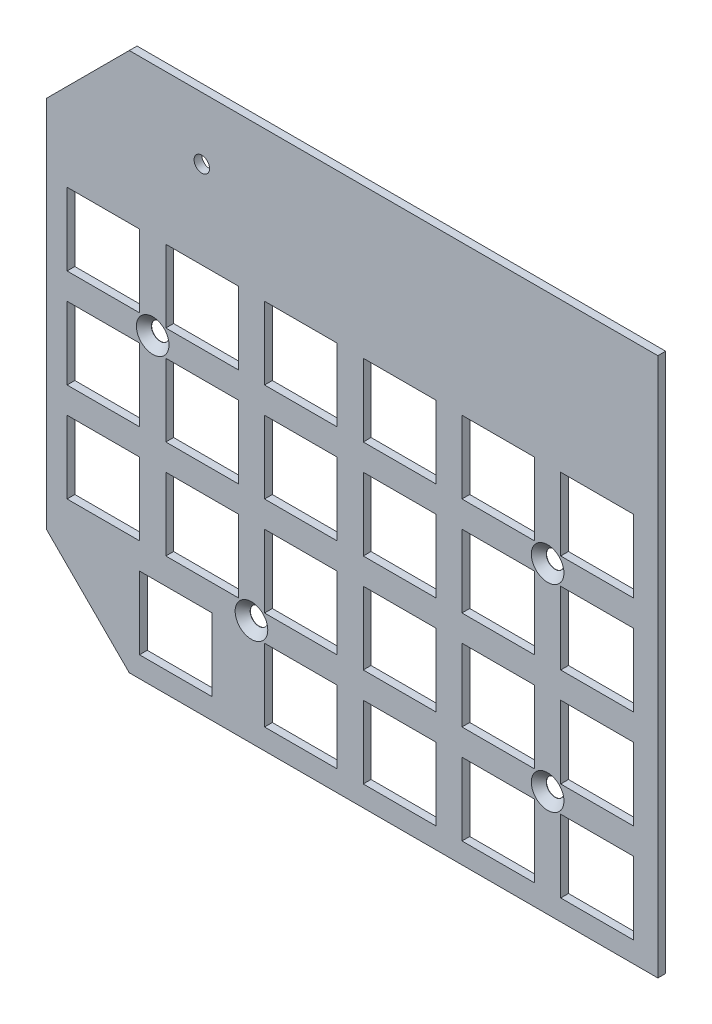
from build123d import *

# Parameters (mm, degrees)
BOSS_EXTRU_1_DEPTH                          = 1.5
ESQUISSE2_R                                 = 1.5
ESQUISSE2_W                                 = 14
ESQUISSE2_H                                 = 14
ENL_V_MAT_EXTRU_1_DEPTH                     = 1.5
FRAISAGE_POUR_VIS_T_TE_FRAIS_E_M31_AT_COUNT = 2
FRAISAGE_POUR_VIS_T_TE_FRAIS_E_M31_AT_PITCH = 76.2
FRAISAGE_POUR_VIS_T_TE_FRAIS_E_M31_2_COUNT  = 2
FRAISAGE_POUR_VIS_T_TE_FRAIS_E_M31_2_PITCH  = 85.194189943
FRAISAGE_POUR_VIS_T_TE_FRAIS_E_M31_3_COUNT  = 2
FRAISAGE_POUR_VIS_T_TE_FRAIS_E_M31_3_PITCH  = 42.597094971


with BuildPart() as part:
    # Esquisse1 → Boss.-Extru.1 (new body)
    with BuildSketch(Plane.XY):
        Polygon((0, -85), (16, -101), (118, -101), (118, 3), (16, 3), (0, -13), align=None)
    extrude(amount=BOSS_EXTRU_1_DEPTH)

    # Esquisse2 → Enlèv. mat.-Extru.1 (cut)
    with BuildSketch(Plane.XY.offset(1.5)):
        with Locations((30, -9)):
            Circle(ESQUISSE2_R)
        with Locations((11, -32.85)):
            Rectangle(ESQUISSE2_W, ESQUISSE2_H)
        with Locations((30.05, -32.85)):
            Rectangle(ESQUISSE2_W, ESQUISSE2_H)
        with Locations((49.1, -32.85)):
            Rectangle(ESQUISSE2_W, ESQUISSE2_H)
        with Locations((68.15, -32.85)):
            Rectangle(ESQUISSE2_W, ESQUISSE2_H)
        with Locations((87.2, -32.85)):
            Rectangle(ESQUISSE2_W, ESQUISSE2_H)
        with Locations((106.25, -32.85)):
            Rectangle(ESQUISSE2_W, ESQUISSE2_H)
        with Locations((30.05, -51.9)):
            Rectangle(ESQUISSE2_W, ESQUISSE2_H)
        with Locations((49.1, -51.9)):
            Rectangle(ESQUISSE2_W, ESQUISSE2_H)
        with Locations((68.15, -51.9)):
            Rectangle(ESQUISSE2_W, ESQUISSE2_H)
        with Locations((87.2, -51.9)):
            Rectangle(ESQUISSE2_W, ESQUISSE2_H)
        with Locations((106.25, -51.9)):
            Rectangle(ESQUISSE2_W, ESQUISSE2_H)
        with Locations((30.05, -70.95)):
            Rectangle(ESQUISSE2_W, ESQUISSE2_H)
        with Locations((49.1, -70.95)):
            Rectangle(ESQUISSE2_W, ESQUISSE2_H)
        with Locations((68.15, -70.95)):
            Rectangle(ESQUISSE2_W, ESQUISSE2_H)
        with Locations((87.2, -70.95)):
            Rectangle(ESQUISSE2_W, ESQUISSE2_H)
        with Locations((106.25, -70.95)):
            Rectangle(ESQUISSE2_W, ESQUISSE2_H)
        with Locations((11, -51.9)):
            Rectangle(ESQUISSE2_W, ESQUISSE2_H)
        with Locations((11, -70.95)):
            Rectangle(ESQUISSE2_W, ESQUISSE2_H)
        with Locations((49.1, -90)):
            Rectangle(ESQUISSE2_W, ESQUISSE2_H)
        with Locations((68.15, -90)):
            Rectangle(ESQUISSE2_W, ESQUISSE2_H)
        with Locations((87.2, -90)):
            Rectangle(ESQUISSE2_W, ESQUISSE2_H)
        with Locations((106.25, -90)):
            Rectangle(ESQUISSE2_W, ESQUISSE2_H)
        with Locations((24.97, -90)):
            Rectangle(ESQUISSE2_W, ESQUISSE2_H)
    extrude(amount=-ENL_V_MAT_EXTRU_1_DEPTH, mode=Mode.SUBTRACT)

    # Esquisse18 → Fraisage pour vis à tête fraisée M31 (revolve, cut)
    with BuildSketch(Plane(origin=(20.525, -42.375, 1.5), x_dir=(0, -1, 0), z_dir=(1, 0, 0))):
        Polygon((0, 0), (0, 1.5), (1.7, 1.5), (1.7, 1.45), (3.15, 0), align=None)
    fraisage_pour_vis_t_te_frais_e_m31 = revolve(axis=Axis((20.525, -42.375, 7.85), (0, 0, -1)), mode=Mode.SUBTRACT)

    # Fraisage pour vis à tête fraisée M31 at: Fraisage pour vis à tête fraisée M31 ×2
    with Locations(*[(i * FRAISAGE_POUR_VIS_T_TE_FRAIS_E_M31_AT_PITCH, 0, 0) for i in range(1, FRAISAGE_POUR_VIS_T_TE_FRAIS_E_M31_AT_COUNT)]):
        add(fraisage_pour_vis_t_te_frais_e_m31, mode=Mode.SUBTRACT)

    # Fraisage pour vis _ t_te frais_e M31 2: Fraisage pour vis à tête fraisée M31 ×2
    with Locations(*[Vector(0.894427190999922, -0.4472135954999458, 0) * (i * FRAISAGE_POUR_VIS_T_TE_FRAIS_E_M31_2_PITCH) for i in range(1, FRAISAGE_POUR_VIS_T_TE_FRAIS_E_M31_2_COUNT)]):
        add(fraisage_pour_vis_t_te_frais_e_m31, mode=Mode.SUBTRACT)

    # Fraisage pour vis _ t_te frais_e M31 3: Fraisage pour vis à tête fraisée M31 ×2
    with Locations(*[Vector(0.44721359550000617, -0.8944271909998918, 0) * (i * FRAISAGE_POUR_VIS_T_TE_FRAIS_E_M31_3_PITCH) for i in range(1, FRAISAGE_POUR_VIS_T_TE_FRAIS_E_M31_3_COUNT)]):
        add(fraisage_pour_vis_t_te_frais_e_m31, mode=Mode.SUBTRACT)


solid = part.part
